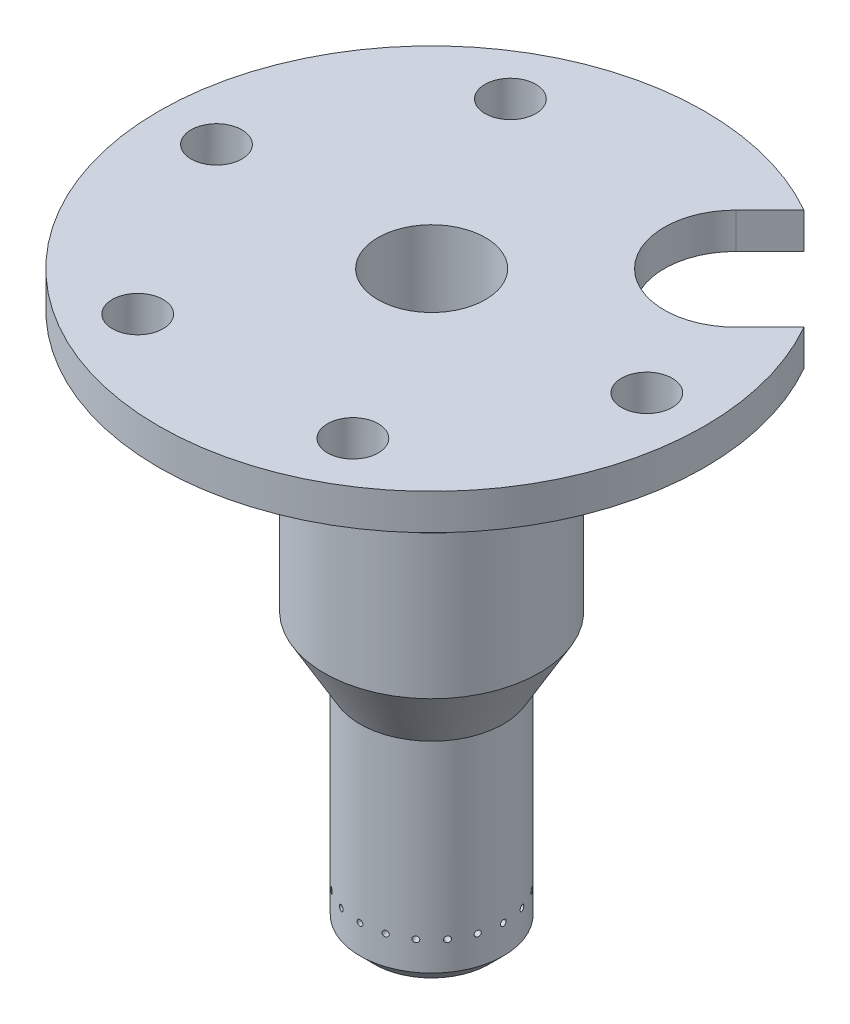
from build123d import *

# Parameters (mm, degrees)
CHAMFER1_SIZE                    = 1.27
CIRPATTERN2_COUNT                = 20
F_3_8_0_375_DIAMETER_HOLE2_D     = 9.525
F_3_8_0_375_DIAMETER_HOLE2_DEPTH = 46.99
F_3_8_0_375_DIAMETER_HOLE2_TIP   = 2.861598698
F_8_CLEARANCE_HOLE1_D            = 4.4958
CIRPATTERN3_COUNT                = 6
CUT_EXTRUDE1_DEPTH               = 62.217699224
CUT_EXTRUDE1_DEPTH_BACK          = 3.175


with BuildPart() as part:
    # Sketch1 → Revolve1 (revolve)
    with BuildSketch(Plane.XY):
        Polygon((6.35, 0), (6.35, 19.05), (9.525, 24.549261314), (9.525, 37.249261314), (12.7, 40.424261314), (12.7, 47.625), (24.1554, 47.625), (24.1554, 50.8), (12.7, 50.8), (0, 50.8), (0, 0), align=None)
    revolve(axis=Axis((0, 0, 0), (0, 1, 0)))

    # Chamfer1
    chamfer1_edges = [part.edges().sort_by_distance(p)[0] for p in [
        (-6.35, 0, 0),
    ]]
    chamfer(chamfer1_edges, length=CHAMFER1_SIZE)

    # Sketch3 → #76 (0.02) Diameter Hole1 (revolve, cut)
    with BuildSketch(Plane(origin=(6.35, 3.81, 0), x_dir=(0, 0, -1), z_dir=(0, 1, 0))):
        Polygon((0, 0), (0, 2.692618597), (0.254, 2.54), (0.254, 0), align=None)
    f_76_0_02_diameter_hole1 = revolve(axis=Axis((12.7, 3.81, 0), (-1, 0, 0)), mode=Mode.SUBTRACT)

    # CirPattern2: #76 (0.02) Diameter Hole1 ×20 about axis
    cirpattern2_axis = Axis((0, 0, 0), (0, -1, 0))
    for i in range(1, CIRPATTERN2_COUNT):
        add(f_76_0_02_diameter_hole1.rotate(cirpattern2_axis, i * 360 / CIRPATTERN2_COUNT), mode=Mode.SUBTRACT)

    # 3/8 (0.375) Diameter Hole2
    with Locations(Plane(origin=(0, 50.8, 0), x_dir=(1, 0, 0), z_dir=(0, 1, 0))):
        with Locations((0, 0)):
            Hole(F_3_8_0_375_DIAMETER_HOLE2_D / 2, depth=F_3_8_0_375_DIAMETER_HOLE2_DEPTH)
            with Locations((0, 0, -(F_3_8_0_375_DIAMETER_HOLE2_DEPTH + F_3_8_0_375_DIAMETER_HOLE2_TIP / 2))):  # 118° drill point
                Cone(0, F_3_8_0_375_DIAMETER_HOLE2_D / 2, F_3_8_0_375_DIAMETER_HOLE2_TIP, mode=Mode.SUBTRACT)

    # #8 Clearance Hole1 (through all)
    with Locations(Plane(origin=(0, 50.8, 0), x_dir=(1, 0, 0), z_dir=(0, 1, 0))):
        with Locations((19.05, 0)):
            f_8_clearance_hole1 = Hole(F_8_CLEARANCE_HOLE1_D / 2)

    # CirPattern3: #8 Clearance Hole1 ×6 about axis, 1 skipped
    cirpattern3_axis = Axis((0, 0, 0), (0, 1, 0))
    add([f_8_clearance_hole1.rotate(cirpattern3_axis, i * 360 / CIRPATTERN3_COUNT) for i in range(1, CIRPATTERN3_COUNT) if i not in (1,)], mode=Mode.SUBTRACT)

    # Sketch11 → Groove for AS 568-020, O-Ring1 (revolve, cut)
    with BuildSketch(Plane(origin=(0, 0, 0), x_dir=(0, 0, -1), z_dir=(-1, 0, 0))):
        with BuildLine():
            Line((11.661862441, -43.293904826), (12.7889, -43.195301816))
            Line((12.7889, -43.195301816), (12.7889, -45.754707835))
            Line((12.7889, -45.754707835), (11.661862441, -45.656104826))
            ThreePointArc((11.661862441, -45.656104826), (11.496731556, -45.574671285), (11.43, -45.403071372))
            Line((11.43, -45.403071372), (11.43, -43.546938279))
            ThreePointArc((11.43, -43.546938279), (11.496731556, -43.375338366), (11.661862441, -43.293904826))
        make_face()
    revolve(axis=Axis((0, -50, 0), (0, 1, 0)), mode=Mode.SUBTRACT)

    # Sketch12 → Cut-Extrude1 (cut, two sides: drawn at the far end of the back side and taken through both)
    with BuildSketch(Plane(origin=(0, 50.8, 0), x_dir=(1, 0, 0), z_dir=(0, 1, 0)).offset(-CUT_EXTRUDE1_DEPTH_BACK)):
        with BuildLine():
            Line((100.82548006, 109.805736181), (11.989569284, 20.969825405))
            Line((11.989569284, 20.969825405), (8.980256121, 17.960512242))
            ThreePointArc((8.980256121, 17.960512242), (8.980256121, 8.980256121), (17.960512242, 8.980256121))
            Line((17.960512242, 8.980256121), (20.969825405, 11.989569284))
            Line((20.969825405, 11.989569284), (109.805736181, 100.82548006))
            Line((109.805736181, 100.82548006), (287.477557733, 278.497301612))
            Line((287.477557733, 278.497301612), (278.497301612, 287.477557733))
            Line((278.497301612, 287.477557733), (100.82548006, 109.805736181))
        make_face()
    extrude(amount=CUT_EXTRUDE1_DEPTH + CUT_EXTRUDE1_DEPTH_BACK, mode=Mode.SUBTRACT)


solid = part.part
